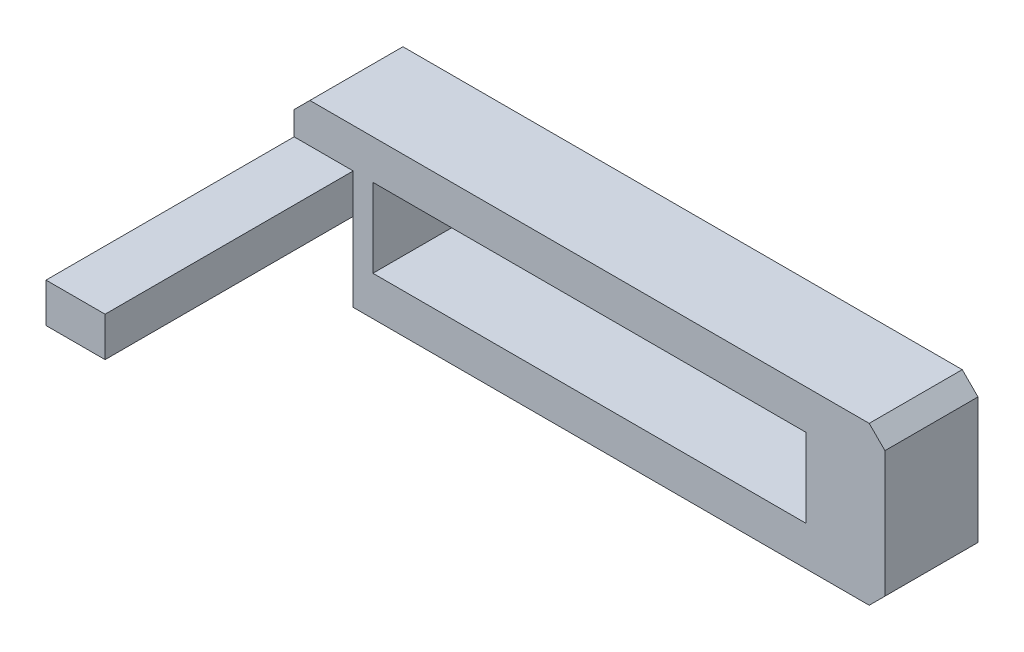
from build123d import *

# Parameters (mm, degrees)
SKETCH1_W           = 95.25
SKETCH1_H           = 25.4
SKETCH1_W_2         = 69.85
SKETCH1_H_2         = 12.7
BOSS_EXTRUDE1_DEPTH = 15
SKETCH2_W           = 9.525
SKETCH2_H           = 6.35
BOSS_EXTRUDE2_DEPTH = 40
CHAMFER1_SIZE       = 2.54
SKETCH4_W           = 9.525
SKETCH4_H           = 12.7
CUT_EXTRUDE2_DEPTH  = 107.384785096


with BuildPart() as part:
    # Sketch1 → Boss-Extrude1 (new body)
    with BuildSketch(Plane.XY):
        with Locations((-47.625, 12.7)):
            Rectangle(SKETCH1_W, SKETCH1_H)
        with Locations((-47.625, 12.7)):
            Rectangle(SKETCH1_W_2, SKETCH1_H_2, mode=Mode.SUBTRACT)
    extrude(amount=BOSS_EXTRUDE1_DEPTH)

    # Sketch2 → Boss-Extrude2 (add)
    with BuildSketch(Plane.XY.offset(15)):
        with Locations((-90.4875, 15.875)):
            Rectangle(SKETCH2_W, SKETCH2_H)
    extrude(amount=BOSS_EXTRUDE2_DEPTH)

    # Chamfer1
    chamfer1_edges = [part.edges().sort_by_distance(p)[0] for p in [
        (0, 0, 7.5),
        (-95.25, 0, 7.5),
        (0, 25.4, 7.5),
        (-95.25, 25.4, 7.5),
    ]]
    chamfer(chamfer1_edges, length=CHAMFER1_SIZE)

    # Sketch4 → Cut-Extrude2 (cut, through all)
    with BuildSketch(Plane.XY.offset(15)):
        with Locations((-90.4875, 6.35)):
            Rectangle(SKETCH4_W, SKETCH4_H)
    extrude(amount=-CUT_EXTRUDE2_DEPTH, mode=Mode.SUBTRACT)


solid = part.part
